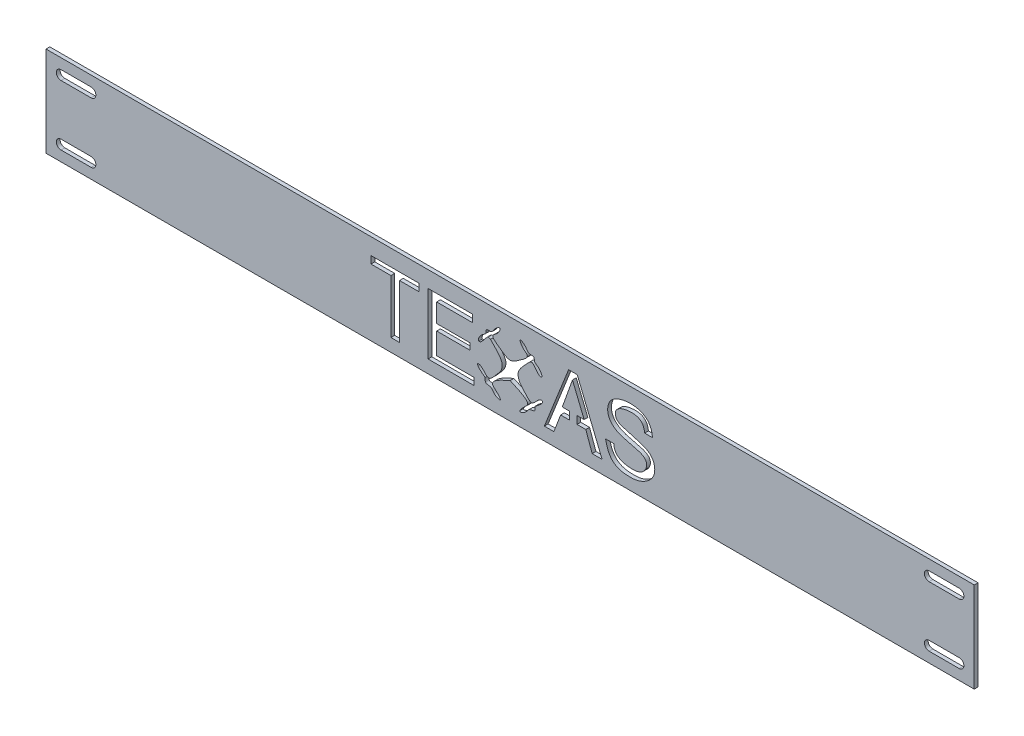
from build123d import *

# Parameters (mm, degrees)
BOSS_EXTRUDE1_DEPTH = 38.1
CUT_EXTRUDE1_DEPTH  = 394.646354208
CUT_EXTRUDE2_DEPTH  = 394.646354318


with BuildPart() as part:
    # Sketch1 → Boss-Extrude1 (new body)
    with BuildSketch(Plane(origin=(0, 0, 0), x_dir=(1, 0, 0), z_dir=(0, 1, 0))):
        Polygon((0, 0), (391.795, 0), (391.795, 1.5875), (366.395, 1.5875), (25.4, 1.5875), (0, 1.5875), align=None)
    extrude(amount=BOSS_EXTRUDE1_DEPTH)

    # Sketch2 → Cut-Extrude1 (cut, through all)
    with BuildSketch(Plane.XY):
        Polygon((145.599472242, 28.090792847), (145.599472242, 5.427829863), (149.22554632, 5.427829863), (149.22554632, 28.090792847), (157.51371564, 28.090792847), (157.51371564, 31.198856342), (137.181800277, 31.198856342), (137.181800277, 28.090792847), align=None)
        Polygon((179.917673333, 31.198856342), (161.269292363, 31.198856342), (161.269292363, 5.427829863), (180.694689206, 5.427829863), (180.694689206, 8.406390712), (164.89536644, 8.406390712), (164.89536644, 17.471575906), (179.011154813, 17.471575906), (179.011154813, 20.191131464), (164.89536644, 20.191131464), (164.89536644, 28.090792847), (179.917673333, 28.090792847), align=None)
        Polygon((220.574953044, 31.18235442), (210.350795054, 5.427829863), (214.365377069, 5.427829863), (217.214435272, 12.938983309), (221.048261248, 12.938983309), (221.048261248, 16.210050092), (217.917474537, 16.210050092), (222.212643587, 28.2483339), (227.128086503, 16.210050092), (224.110778043, 16.210050092), (224.110778043, 12.938983309), (227.833652214, 12.938983309), (230.539048789, 5.466935623), (234.708058378, 5.466935623), (224.208000798, 31.18235442), align=None)
        with BuildLine():
            Line((239.646613445, 13.698418454), (236.18490982, 13.698418454))
            add(Edge.make_bspline(
                [(236.18490982, 13.698418454), (237.539923456, 6.285696801), (242.060956994, 4.789615381), (251.561880766, 4.959138211), (257.377420696, 9.042385401), (256.474831979, 18.527233582), (250.964221287, 19.389165217), (242.951859883, 21.830005981), (240.412235017, 22.597663201), (240.112623117, 27.539154047), (247.068389713, 29.749000012), (252.241734163, 27.948244824), (252.693940004, 24.043132646)],
                knots=[0, 0, 0, 0, 0.215233767, 0.260042758, 0.427195779, 0.47611847, 0.700346978, 0.738892161, 0.823025123, 0.844326339, 0.930603106, 1, 1, 1, 1], degree=3))
            Line((252.693940004, 24.043132646), (255.964863145, 24.043132646))
            add(Edge.make_bspline(
                [(255.964863145, 24.043132646), (255.775827656, 27.850996611), (251.089752425, 33.453455429), (238.787771521, 31.365745709), (236.303272731, 23.767049765), (238.388257273, 19.234584661), (248.331787083, 16.606425648), (253.260046834, 15.867321452), (253.707072411, 11.287876463), (251.446173061, 8.162055748), (244.152713387, 8.2705598), (239.850142074, 9.541666951), (239.646613445, 13.698418454)],
                knots=[0, 0, 0, 0, 0.158980188, 0.386457485, 0.435551383, 0.626100531, 0.666569149, 0.799768946, 0.826978102, 0.911451556, 0.929809664, 1, 1, 1, 1], degree=3))
        make_face()
        with BuildLine():
            add(Edge.make_bspline(
                [(185.371433501, 10.72961163), (182.840684775, 12.435116206), (181.665510249, 14.140142079), (183.675119006, 14.557380933), (184.927520655, 12.461540422), (186.829185531, 11.047595574), (187.44995088, 11.267653423), (188.672452614, 12.490155157)],
                knots=[0, 0, 0, 0, 0.181965627, 0.253330638, 0.662503509, 0.742285106, 1, 1, 1, 1], degree=3))
            add(Edge.make_bspline(
                [(185.371433501, 10.72961163), (185.246005596, 9.002836231), (185.984780358, 8.645738416), (188.253528413, 8.5894639), (188.919228599, 6.32097164), (192.945387005, 4.910077323), (190.178955956, 8.159082236), (186.022703076, 11.124772969), (195.122792719, 14.355335047), (195.8975, 14.858401812)],
                knots=[0, 0, 0, 0, 0.059560811, 0.132379694, 0.259094126, 0.36015788, 0.491405112, 0.595160116, 1, 1, 1, 1], degree=3))
            add(Edge.make_bspline(
                [(206.423566499, 10.72961163), (206.548994404, 9.002836231), (205.810219642, 8.645738416), (203.541471587, 8.5894639), (202.875771401, 6.32097164), (198.849612995, 4.910077323), (201.616044044, 8.159082236), (205.772296924, 11.124772969), (196.672207281, 14.355335047), (195.8975, 14.858401812)],
                knots=[0, 0, 0, 0, 0.059560811, 0.132379694, 0.259094126, 0.36015788, 0.491405112, 0.595160116, 1, 1, 1, 1], degree=3))
            add(Edge.make_bspline(
                [(206.423566499, 10.72961163), (208.954315225, 12.435116206), (210.129489751, 14.140142079), (208.119880994, 14.557380933), (206.867479345, 12.461540422), (204.965814469, 11.047595574), (204.34504912, 11.267653423), (203.122547386, 12.490155157)],
                knots=[0, 0, 0, 0, 0.181965627, 0.253330638, 0.662503509, 0.742285106, 1, 1, 1, 1], degree=3))
            add(Edge.make_bspline(
                [(203.122547386, 12.490155157), (201.060860551, 14.691178486), (199.620875616, 16.084593033), (198.848230859, 20.718669182), (201.696790695, 23.130607044), (204.187255868, 25.801540708)],
                knots=[0, 0, 0, 0, 0.394261637, 0.494261637, 1, 1, 1, 1], degree=3))
            add(Edge.make_bspline(
                [(204.187255868, 25.801540708), (204.932551822, 26.261786659), (206.193884374, 25.844737016), (208.05151738, 22.233500952), (209.138560445, 22.680645754)],
                knots=[0, 0, 0, 0, 0.315304404, 1, 1, 1, 1], degree=3))
            add(Edge.make_bspline(
                [(209.138560445, 22.680645754), (209.659640125, 23.049062671), (208.361358095, 25.626031095), (207.041440806, 26.102923152), (205.946350959, 27.065221331), (206.424474704, 29.068899851), (203.344500204, 28.198513631), (202.816343528, 30.683327615), (199.032688879, 32.858694888), (201.308646873, 28.893645419), (203.230395664, 28.110681318), (203.064045942, 26.540644164), (199.605808835, 24.063105945), (196.965983065, 22.225006798), (195.8975, 22.308330673)],
                knots=[0, 0, 0, 0, 0.138762041, 0.259762706, 0.279833189, 0.339466872, 0.421314918, 0.521201875, 0.623023697, 0.751654429, 0.836142573, 0.853089434, 0.921123038, 1, 1, 1, 1], degree=3))
            add(Edge.make_bspline(
                [(182.656439555, 22.680645754), (182.135359875, 23.049062671), (183.433641905, 25.626031095), (184.753559194, 26.102923152), (185.848649041, 27.065221331), (185.370525296, 29.068899851), (188.450499796, 28.198513631), (188.978656472, 30.683327615), (192.762311121, 32.858694888), (190.486353127, 28.893645419), (188.564604336, 28.110681318), (188.730954058, 26.540644164), (192.189191165, 24.063105945), (194.829016935, 22.225006798), (195.8975, 22.308330673)],
                knots=[0, 0, 0, 0, 0.138762041, 0.259762706, 0.279833189, 0.339466872, 0.421314918, 0.521201875, 0.623023697, 0.751654429, 0.836142573, 0.853089434, 0.921123038, 1, 1, 1, 1], degree=3))
            add(Edge.make_bspline(
                [(187.607744132, 25.801540708), (186.862448178, 26.261786659), (185.601115626, 25.844737016), (183.74348262, 22.233500952), (182.656439555, 22.680645754)],
                knots=[0, 0, 0, 0, 0.315304404, 1, 1, 1, 1], degree=3))
            add(Edge.make_bspline(
                [(188.672452614, 12.490155157), (190.734139449, 14.691178486), (192.174124384, 16.084593033), (192.946769141, 20.718669182), (190.098209305, 23.130607044), (187.607744132, 25.801540708)],
                knots=[0, 0, 0, 0, 0.394261637, 0.494261637, 1, 1, 1, 1], degree=3))
        make_face()
    extrude(amount=-CUT_EXTRUDE1_DEPTH, mode=Mode.SUBTRACT)

    # Sketch3 → Cut-Extrude2 (cut, through all)
    with BuildSketch(Plane.XY):
        with BuildLine():
            Line((6.35, 33.734375), (19.05, 33.734375))
            ThreePointArc((19.05, 33.734375), (21.034375, 31.75), (19.05, 29.765625))
            Line((19.05, 29.765625), (6.35, 29.765625))
            ThreePointArc((6.35, 29.765625), (4.365625, 31.75), (6.35, 33.734375))
        make_face()
        with BuildLine():
            Line((6.35, 4.365625), (19.05, 4.365625))
            ThreePointArc((19.05, 4.365625), (21.034375, 6.35), (19.05, 8.334375))
            Line((19.05, 8.334375), (6.35, 8.334375))
            ThreePointArc((6.35, 8.334375), (4.365625, 6.35), (6.35, 4.365625))
        make_face()
        with BuildLine():
            Line((385.445, 4.365625), (372.745, 4.365625))
            ThreePointArc((372.745, 4.365625), (370.760625, 6.35), (372.745, 8.334375))
            Line((372.745, 8.334375), (385.445, 8.334375))
            ThreePointArc((385.445, 8.334375), (387.429375, 6.35), (385.445, 4.365625))
        make_face()
        with BuildLine():
            Line((385.445, 33.734375), (372.745, 33.734375))
            ThreePointArc((372.745, 33.734375), (370.760625, 31.75), (372.745, 29.765625))
            Line((372.745, 29.765625), (385.445, 29.765625))
            ThreePointArc((385.445, 29.765625), (387.429375, 31.75), (385.445, 33.734375))
        make_face()
    extrude(amount=-CUT_EXTRUDE2_DEPTH, mode=Mode.SUBTRACT)


solid = part.part
